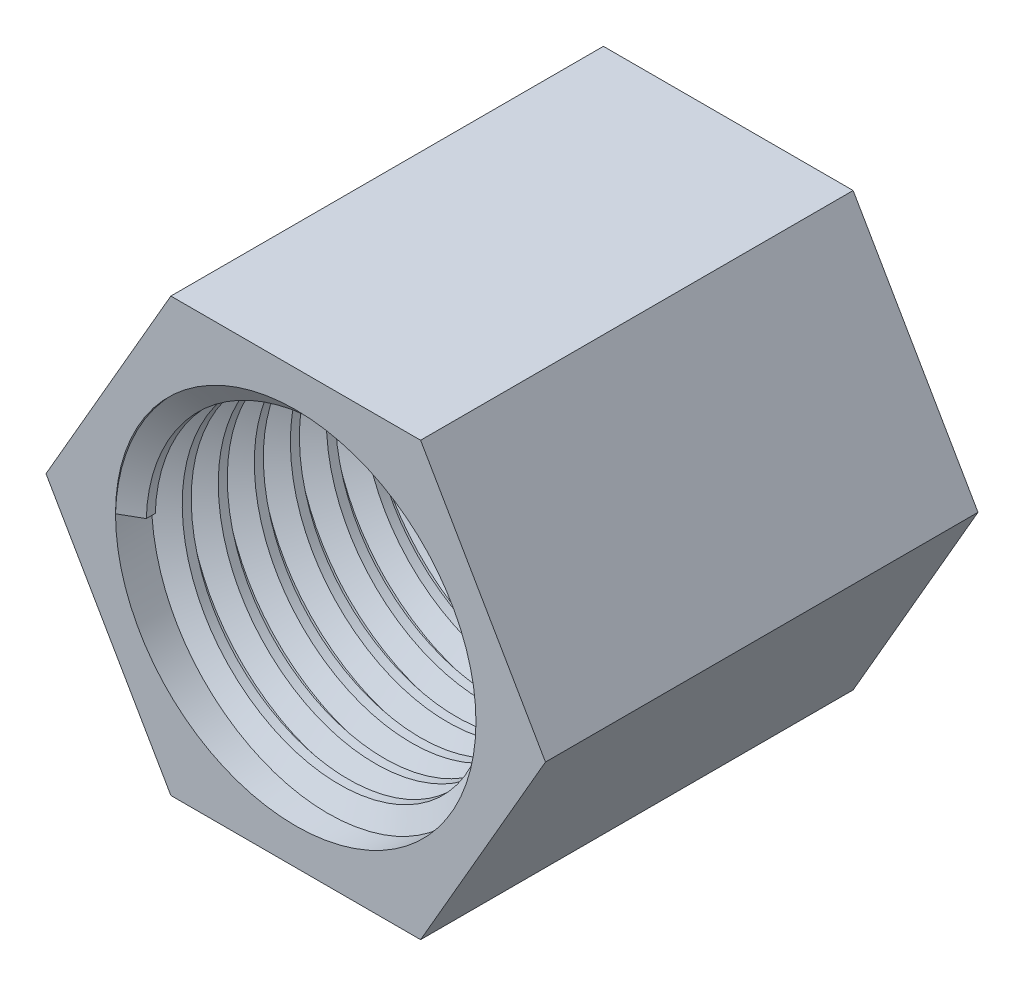
from build123d import *
from build123d.topology import SkipClean

# Parameters (mm, degrees)
BOSS_EXTRUDE1_DEPTH = 12
SKETCH2_R           = 5
CUT_EXTRUDE1_DEPTH  = 10
THREAD1_PITCH       = 1


with BuildPart() as part:
    # Sketch1 → Boss-Extrude1 (new body)
    with BuildSketch(Plane.XY):
        Polygon((6.92820323, 0), (3.464101615, 6), (-3.464101615, 6), (-6.92820323, 0), (-3.464101615, -6), (3.464101615, -6), align=None)
    extrude(amount=BOSS_EXTRUDE1_DEPTH)

    # Sketch2 → Cut-Extrude1 (cut)
    with BuildSketch(Plane.XY.offset(12)):
        Circle(SKETCH2_R)
    extrude(amount=-CUT_EXTRUDE1_DEPTH, mode=Mode.SUBTRACT)

    # Thread1: the profile of Thread Profile1 profile screwed along a right-hand helix of 10 turns, 8 arcs to a turn; built about Z, then put on its axis
    with SkipClean():  # the faces are left unmerged after this step: merging them gives an invalid solid
        thread1_z = Axis((0, 0, 0), (0, 0, 1))
        thread1_corners = [(5.0003, 0, -0.000173205), (5.0003, 0, 0.875173202), (4.458734125, 0, 0.562499999), (4.458734125, 0, 0.312499999)]
        with BuildLine(mode=Mode.PRIVATE) as thread1_profile:
            Line(thread1_corners[0], thread1_corners[1])
            Line(thread1_corners[1], thread1_corners[2])
            Line(thread1_corners[2], thread1_corners[3])
            Line(thread1_corners[3], thread1_corners[0])
        thread1_cap = Face(thread1_profile.wire())
        thread1_turn_angles = [0, 22.5, 45, 67.5, 90, 112.5, 135, 157.5, 180, 202.5, 225, 247.5, 270, 292.5, 315, 337.5, 360]
        thread1_turn_weights = [1, 0.9238795325112867, 1, 0.9238795325112867, 1, 0.9238795325112867, 1, 0.9238795325112867, 1, 0.9238795325112867, 1, 0.9238795325112867, 1, 0.9238795325112867, 1, 0.9238795325112867, 1]
        thread1_turn_rails = [Edge.make_bspline([Vector(p[0], p[1], 0).rotate(thread1_z, thread1_turn_angles[k]) / thread1_turn_weights[k] + Vector(0, 0, p[2] + THREAD1_PITCH * thread1_turn_angles[k] / 360) for k in range(17)], [0, 0, 0, 1, 1, 2, 2, 3, 3, 4, 4, 5, 5, 6, 6, 7, 7, 8, 8, 8], 2, thread1_turn_weights) for p in thread1_corners]
        thread1_turn_sides = [Face.make_surface_from_curves(thread1_turn_rails[p[0]], thread1_turn_rails[p[1]]) for p in [(0, 1), (1, 2), (2, 3), (3, 0)]]
        thread1 = Plane(origin=(0, 0, 12), x_dir=(-1, 0, 0), z_dir=(0, 0, -1)) * Solid(Shell([*[p.moved(Location((0, 0, THREAD1_PITCH * i))) for i in range(10) for p in thread1_turn_sides], thread1_cap, thread1_cap.rotate(thread1_z, 3600).moved(Location((0, 0, THREAD1_PITCH * 3600 / 360)))]))
        add(thread1)


solid = part.part
